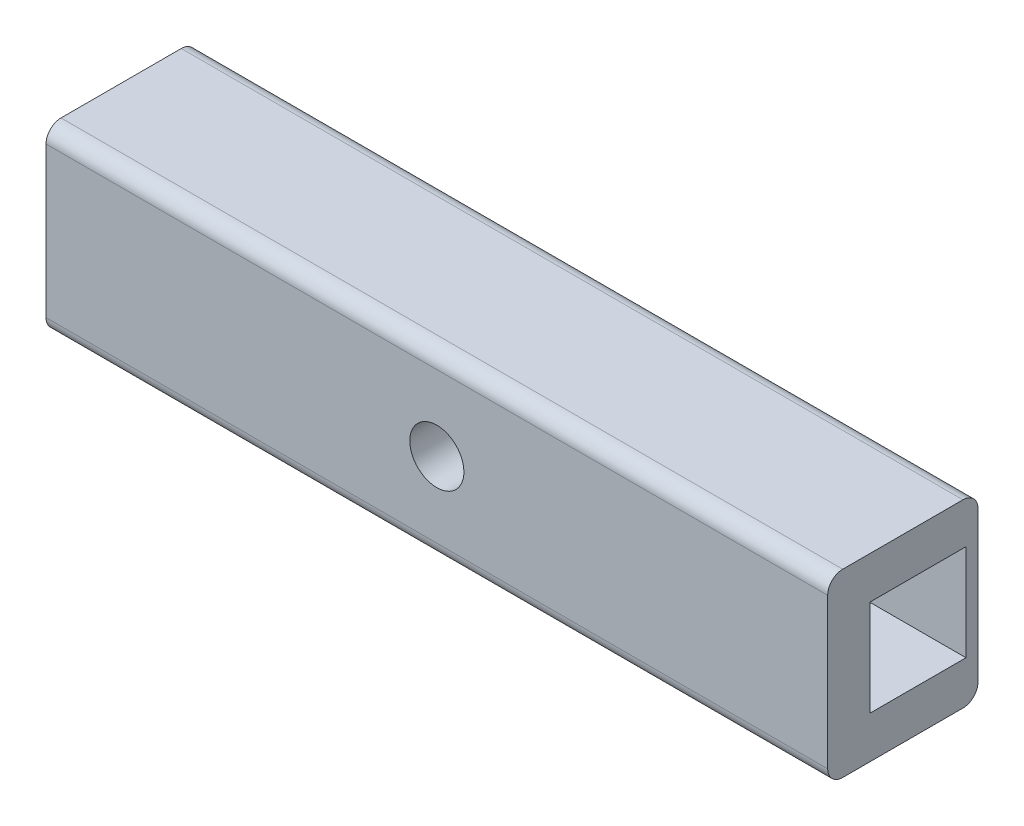
from build123d import *

# Parameters (mm, degrees)
SKETCH3_R             = 3
BOSS_EXTRUDE1_DEPTH   = 6
BOSS_EXTRUDE2_START   = -3
SKETCH4_W             = 6
SKETCH4_H             = 6
BOSS_EXTRUDE2_DEPTH   = 13
SKETCH5_W             = 3.2
SKETCH5_H             = 3.2
CUT_EXTRUDE1_DEPTH    = 10
SKETCH6_R             = 0.9
CUT_EXTRUDE2_DEPTH    = 15.628738838
MIRROR2_DEPTH         = 6
MIRROR2_2_OUTLINE_W   = 10
MIRROR2_2_OUTLINE_H   = 3.2
MIRROR2_2_DEPTH       = 1.4
MIRROR2_START         = 4.6
MIRROR2_3_OUTLINE_W   = 10
MIRROR2_3_OUTLINE_H   = 3.2
MIRROR2_3_DEPTH       = 1.4
SKETCH8_W             = 26
SKETCH8_H             = 6
CUT_EXTRUDE3_DEPTH    = 1
FILLET1_R             = 0.5
BODY_MOVE_COPY1_ANGLE = 90


with BuildPart() as part:
    # Sketch3 → Boss-Extrude1 (new body)
    with BuildSketch(Plane(origin=(0, 0, 0), x_dir=(1, 0, 0), z_dir=(0, 1, 0))):
        with Locations(Location((0, 0, 0), (0, 0, 270))):
            Circle(SKETCH3_R)
    extrude(amount=BOSS_EXTRUDE1_DEPTH)

    # Sketch4 → Boss-Extrude2 (add)
    with BuildSketch(Plane.ZY.offset(3).offset(BOSS_EXTRUDE2_START)):
        with Locations((0, 3)):
            Rectangle(SKETCH4_W, SKETCH4_H)
    extrude(amount=BOSS_EXTRUDE2_DEPTH)

    # Sketch5 → Cut-Extrude1 (cut)
    with BuildSketch(Plane.ZY.offset(13)):
        with Locations((0, 3)):
            Rectangle(SKETCH5_W, SKETCH5_H)
    extrude(amount=-CUT_EXTRUDE1_DEPTH, mode=Mode.SUBTRACT)

    # Sketch6 → Cut-Extrude2 (cut, through all)
    with BuildSketch(Plane(origin=(0, 6, 0), x_dir=(1, 0, 0), z_dir=(0, 1, 0))):
        with Locations(Location((0, 0, 0), (0, 0, 270))):
            Circle(SKETCH6_R)
    extrude(amount=-CUT_EXTRUDE2_DEPTH, mode=Mode.SUBTRACT)

    # Mirror2: read off the stored shape, not the designer's step
    # Mirror2 outline → Mirror2 (add)
    with BuildSketch(Plane(origin=(0, 0, 0), x_dir=(1, 0, 0), z_dir=(0, 1, 0))):
        with BuildLine():
            Line((13, 1.6), (13, 3))
            Line((13, 3), (0, 3))
            ThreePointArc((0, 3), (2.121320344, 2.121320344), (3, 0))
            Line((3, 0), (3, 1.6))
            Line((3, 1.6), (13, 1.6))
        make_face()
        with BuildLine():
            Line((13, -3), (13, -1.6))
            Line((13, -1.6), (3, -1.6))
            Line((3, -1.6), (3, 0))
            ThreePointArc((3, 0), (2.121320344, -2.121320344), (0, -3))
            Line((0, -3), (13, -3))
        make_face()
    extrude(amount=MIRROR2_DEPTH)

    # Mirror2 2 outline → Mirror2 2 (add)
    with BuildSketch(Plane(origin=(0, 0, 0), x_dir=(1, 0, 0), z_dir=(0, 1, 0))):
        with Locations((8, 0)):
            Rectangle(MIRROR2_2_OUTLINE_W, MIRROR2_2_OUTLINE_H)
    extrude(amount=MIRROR2_2_DEPTH)

    # Mirror2 3 outline → Mirror2 3 (add)
    with BuildSketch(Plane(origin=(0, 0, 0), x_dir=(1, 0, 0), z_dir=(0, 1, 0)).offset(MIRROR2_START)):
        with Locations((8, 0)):
            Rectangle(MIRROR2_3_OUTLINE_W, MIRROR2_3_OUTLINE_H)
    extrude(amount=MIRROR2_3_DEPTH)

    # Sketch8 → Cut-Extrude3 (cut)
    with BuildSketch(Plane.XZ):
        Rectangle(SKETCH8_W, SKETCH8_H)
    extrude(amount=-CUT_EXTRUDE3_DEPTH, mode=Mode.SUBTRACT)

    # Fillet1
    fillet1_edges = [part.edges().sort_by_distance(p)[0] for p in [
        (0, 1, 3),
        (0, 1, -3),
        (0, 6, 3),
        (0, 6, -3),
    ]]
    fillet(fillet1_edges, radius=FILLET1_R)


with BuildPart() as part_1:
    # Body-Move/Copy1: moved
    add(part.part.rotate(Axis((0, 3.5, 0), (1, 0, 0)), BODY_MOVE_COPY1_ANGLE))


with BuildPart() as part_2:
    # Body-Move/Copy2: read off the stored shape, not the designer's step
    # Body-Move/Copy2: moved
    add(part_1.part.moved(Location((0, -3.5, 0.5))))


solid = part_2.part
